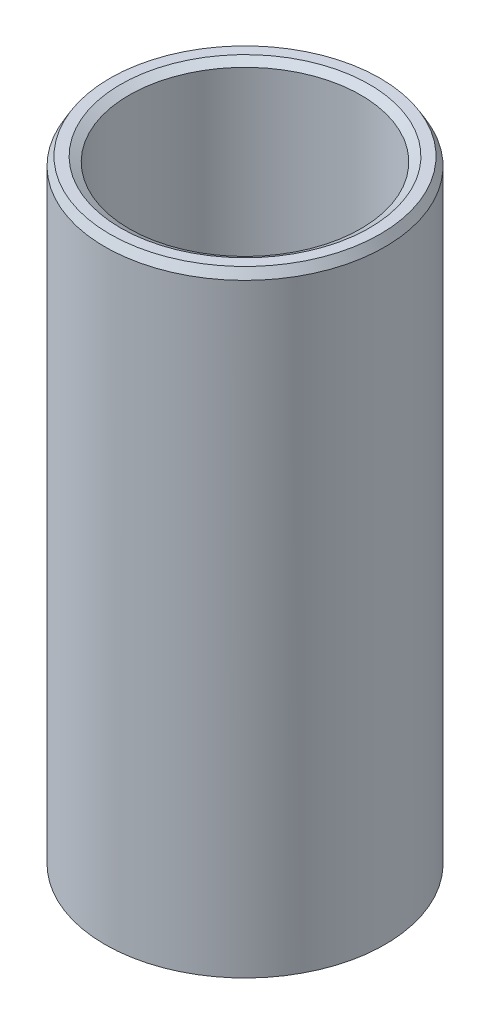
from build123d import *
from OCP.BRepFilletAPI import BRepFilletAPI_MakeChamfer

# Parameters (mm, degrees)
SKETCH1_R           = 45
BOSS_EXTRUDE1_DEPTH = 198.479711633
SKETCH2_R           = 37.223891145
CUT_EXTRUDE1_DEPTH  = 209.432713196
CHAMFER1_SIZE       = 2.752531978
CHAMFER1_SIZE2      = 1.589175078


with BuildPart() as part:
    # Sketch1 → Boss-Extrude1 (new body)
    with BuildSketch(Plane(origin=(0, 0, 0), x_dir=(1, 0, 0), z_dir=(0, 1, 0))):
        Circle(SKETCH1_R)
    extrude(amount=BOSS_EXTRUDE1_DEPTH)

    # Sketch2 → Cut-Extrude1 (cut, through all)
    with BuildSketch(Plane(origin=(0, 0, 0), x_dir=(1, 0, 0), z_dir=(0, 1, 0))):
        Circle(SKETCH2_R)
    extrude(amount=CUT_EXTRUDE1_DEPTH, mode=Mode.SUBTRACT)

    # Chamfer1: one chamfer whose edges measure the first distance from different faces: ONE call of the kernel's chamfer builder (chamfer() names one face for all edges)
    chamfer1_edges_1 = [part.edges().sort_by_distance(p)[0] for p in [
        (-37.223891145, 198.479711633, 0),
    ]]
    chamfer1_side_1 = [part.faces().sort_by_distance(p)[0] for p in [
        (-43.727207794, 198.479711633, 0),
    ]]
    chamfer1_edges_2 = [part.edges().sort_by_distance(p)[0] for p in [
        (-37.223891145, 0, 0),
    ]]
    chamfer1_side_2 = [part.faces().sort_by_distance(p)[0] for p in [
        (-37.223891145, 99.239855817, 0),
    ]]
    chamfer1_edges_3 = [part.edges().sort_by_distance(p)[0] for p in [
        (-45, 0, 0),
    ]]
    chamfer1_side_3 = [part.faces().sort_by_distance(p)[0] for p in [
        (-43.727207794, 0, 0),
    ]]
    chamfer1_edges_4 = [part.edges().sort_by_distance(p)[0] for p in [
        (-45, 198.479711633, 0),
    ]]
    chamfer1_side_4 = [part.faces().sort_by_distance(p)[0] for p in [
        (-45, 99.239855817, 0),
    ]]
    chamfer1 = BRepFilletAPI_MakeChamfer(part.part.solid().wrapped)
    for e in chamfer1_edges_1:
        chamfer1.Add(CHAMFER1_SIZE, CHAMFER1_SIZE2, e.wrapped, chamfer1_side_1[0].wrapped)  # the first distance lies on this face
    for e in chamfer1_edges_2:
        chamfer1.Add(CHAMFER1_SIZE, CHAMFER1_SIZE2, e.wrapped, chamfer1_side_2[0].wrapped)  # the first distance lies on this face
    for e in chamfer1_edges_3:
        chamfer1.Add(CHAMFER1_SIZE, CHAMFER1_SIZE2, e.wrapped, chamfer1_side_3[0].wrapped)  # the first distance lies on this face
    for e in chamfer1_edges_4:
        chamfer1.Add(CHAMFER1_SIZE, CHAMFER1_SIZE2, e.wrapped, chamfer1_side_4[0].wrapped)  # the first distance lies on this face
    add(Compound.cast(chamfer1.Shape()), mode=Mode.REPLACE)


solid = part.part
